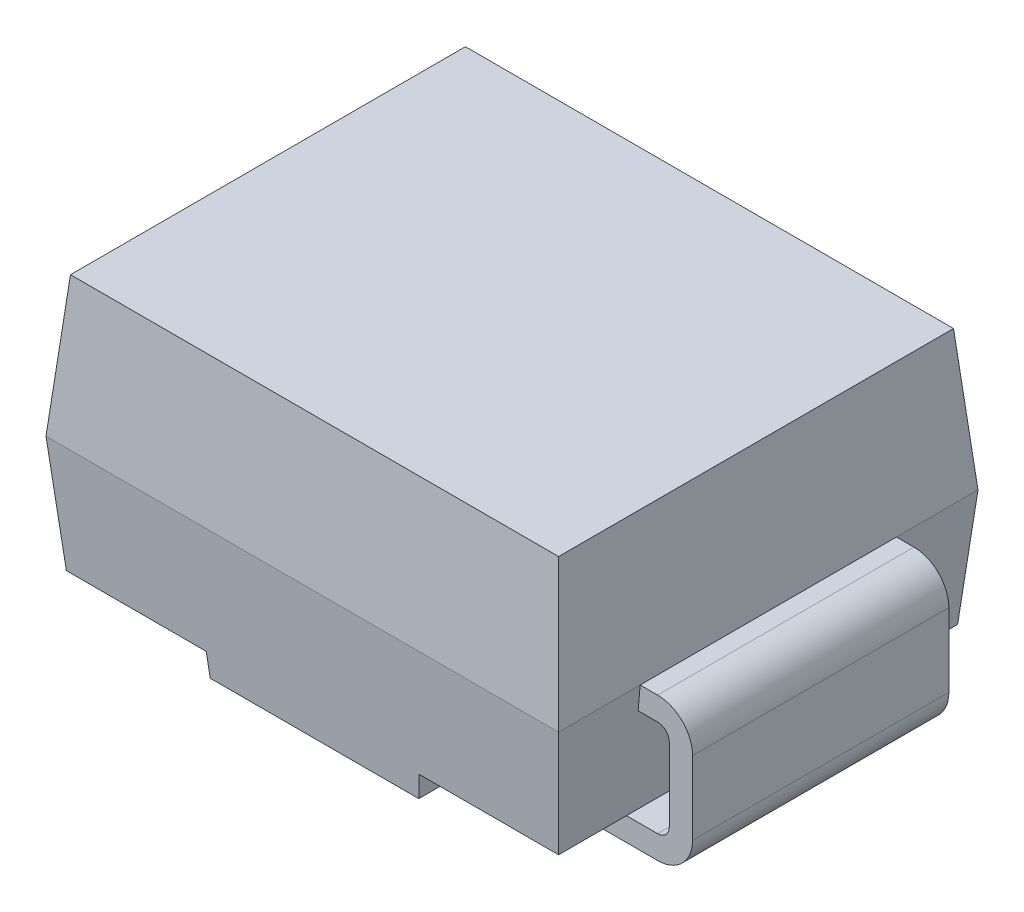
from build123d import *

# Parameters (mm, degrees)
EXTRUDE1_START      = -2.2
EXTRUDE1_DEPTH      = 4.4
EXTRUDE1_START_2    = -3
EXTRUDE1_2_DEPTH    = 6
SKETCH1_3_W         = 2
SKETCH1_3_H         = 3.6
EXTRUDE2_DEPTH      = 1.2
EXTRUDE2_DRAFT      = -5
EXTRUDE3_DEPTH      = 1.1
EXTRUDE3_DEPTH_BACK = 1.1
FILLET1_R           = 0.1
FILLET2_R           = 0.3


with BuildPart() as part:
    # Extrude1: read off the stored shape, not the designer's step
    # Extrude1 outline → Extrude1 (new body)
    with BuildSketch(Plane.YZ.offset(EXTRUDE1_START)):
        Polygon((-1, -1.712511336), (0, -1.8), (1.2, -1.695013604), (1.2, 1.695013604), (0, 1.8), (-1, 1.712511336), align=None)
    extrude(amount=EXTRUDE1_DEPTH)

    # Extrude1 2 outline → Extrude1 2 (cut)
    with BuildSketch(Plane.XY.offset(EXTRUDE1_START_2)):
        Polygon((-2.2, 0), (-2.095013604, 1.2), (-2.2, 1.2), align=None)
        Polygon((-2.112511336, -1), (-2.2, 0), (-2.2, -1), align=None)
        Polygon((2.2, 1.2), (2.095013604, 1.2), (2.2, 0), align=None)
        Polygon((2.2, -1), (2.2, 0), (2.112511336, -1), align=None)
    extrude(amount=EXTRUDE1_2_DEPTH, mode=Mode.SUBTRACT)


with BuildPart() as extrude2_tool:
    # Sketch1<3> → Extrude2 (with draft: the straight prism first)
    with BuildSketch(Plane(origin=(0, 0, 0), x_dir=(1, 0, 0), z_dir=(0, 1, 0))):
        Rectangle(SKETCH1_3_W, SKETCH1_3_H)
    extrude(amount=-EXTRUDE2_DEPTH)
    # Extrude2: the draft: its side faces are tilted about the plane it starts from
    extrude2_sides = [extrude2_tool.faces().sort_by_distance(p)[0] for p in [
        (1, -0.6, 0),
        (0, -0.6, -1.8),
        (-1, -0.6, 0),
        (0, -0.6, 1.8),
    ]]
    draft(extrude2_sides, Plane(origin=(0, 0, 0), x_dir=(1, 0, 0), z_dir=(0, 1, 0)), EXTRUDE2_DRAFT)


with BuildPart() as part_1:
    add(part.part)

    # Extrude2: add extrude2_tool
    add(extrude2_tool.part)

    # Sketch2 → Extrude3 (add, two sides: drawn at the far end of the back side and taken through both)
    with BuildSketch(Plane.XY.offset(-EXTRUDE3_DEPTH_BACK)):
        Polygon((-2.2, 0), (-2.65, 0), (-2.65, -1.23), (-1.15, -1.23), (-1.15, -1.03), (-2.45, -1.03), (-2.45, -0.2), (-1.852332632, -0.2), (-1.852332632, 0), align=None)
        Polygon((1.852332632, 0), (2.2, 0), (2.65, 0), (2.65, -1.23), (1.15, -1.23), (1.15, -1.03), (2.45, -1.03), (2.45, -0.2), (1.852332632, -0.2), align=None)
    extrude(amount=EXTRUDE3_DEPTH + EXTRUDE3_DEPTH_BACK)

    # Fillet1
    fillet1_edges = [part_1.edges().sort_by_distance(p)[0] for p in [
        (-2.45, -1.03, 0),
        (-2.45, -0.2, 0),
        (2.45, -0.2, 0),
        (2.45, -1.03, 0),
    ]]
    fillet(fillet1_edges, radius=FILLET1_R)

    # Fillet2
    fillet2_edges = [part_1.edges().sort_by_distance(p)[0] for p in [
        (-2.65, 0, 0),
        (-2.65, -1.23, 0),
        (2.65, 0, 0),
        (2.65, -1.23, 0),
    ]]
    fillet(fillet2_edges, radius=FILLET2_R)


solid = part_1.part
